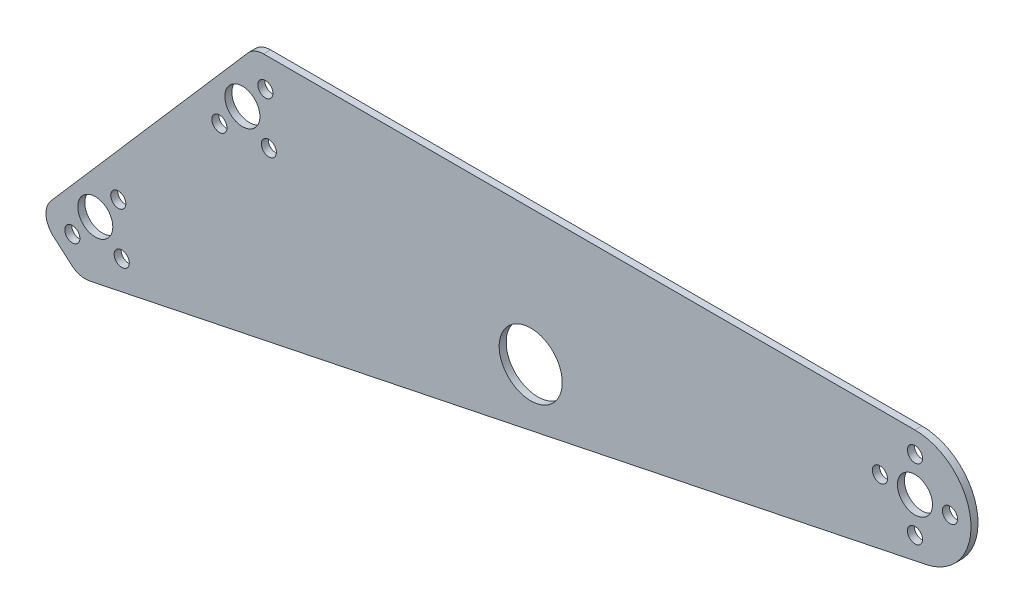
from build123d import *

# Parameters (mm, degrees)
SKETCH1_R           = 7.9375
SKETCH1_R_2         = 3.429
SKETCH1_R_3         = 14.2875
BOSS_EXTRUDE1_DEPTH = 3.175


with BuildPart() as part:
    # Sketch1 → Boss-Extrude1 (new body)
    with BuildSketch(Plane.XY):
        with BuildLine():
            Line((304.8, 25.4), (9.593010709, 25.4))
            ThreePointArc((9.593010709, 25.4), (5.643057573, 24.542381105), (2.404401957, 22.123962251))
            Line((2.404401957, 22.123962251), (-86.655346099, -80.327558268))
            ThreePointArc((-86.655346099, -80.327558268), (-88.968534927, -87.240950932), (-85.715699599, -93.765129271))
            Line((-85.715699599, -93.765129271), (-77.389837916, -101.002690413))
            ThreePointArc((-77.389837916, -101.002690413), (-73.552808487, -103.028646494), (-69.21525712, -103.142405102))
            Line((-69.21525712, -103.142405102), (309.934982787, -24.875529176))
            ThreePointArc((309.934982787, -24.875529176), (330.068542113, 2.580848594), (304.8, 25.4))
        make_face()
        with Locations((304.8, 0)):
            Circle(SKETCH1_R, mode=Mode.SUBTRACT)
        Circle(SKETCH1_R, mode=Mode.SUBTRACT)
        with Locations((-66.655597345, -76.678493351)):
            Circle(SKETCH1_R, mode=Mode.SUBTRACT)
        with Locations((304.8, 15.875)):
            Circle(SKETCH1_R_2, mode=Mode.SUBTRACT)
        with Locations((320.675, 0)):
            Circle(SKETCH1_R_2, mode=Mode.SUBTRACT)
        with Locations((304.8, -15.875)):
            Circle(SKETCH1_R_2, mode=Mode.SUBTRACT)
        with Locations((288.925, 0)):
            Circle(SKETCH1_R_2, mode=Mode.SUBTRACT)
        with Locations((-56.24066026, -64.697478765)):
            Circle(SKETCH1_R_2, mode=Mode.SUBTRACT)
        with Locations((-54.674582759, -87.093430436)):
            Circle(SKETCH1_R_2, mode=Mode.SUBTRACT)
        with Locations((-77.070534431, -88.659507937)):
            Circle(SKETCH1_R_2, mode=Mode.SUBTRACT)
        with Locations((-10.414937085, -11.981014586)):
            Circle(SKETCH1_R_2, mode=Mode.SUBTRACT)
        with Locations((11.981014586, -10.414937085)):
            Circle(SKETCH1_R_2, mode=Mode.SUBTRACT)
        with Locations((10.414937085, 11.981014586)):
            Circle(SKETCH1_R_2, mode=Mode.SUBTRACT)
        with Locations((130.671295769, -35.944879509)):
            Circle(SKETCH1_R_3, mode=Mode.SUBTRACT)
    extrude(amount=BOSS_EXTRUDE1_DEPTH)


solid = part.part
